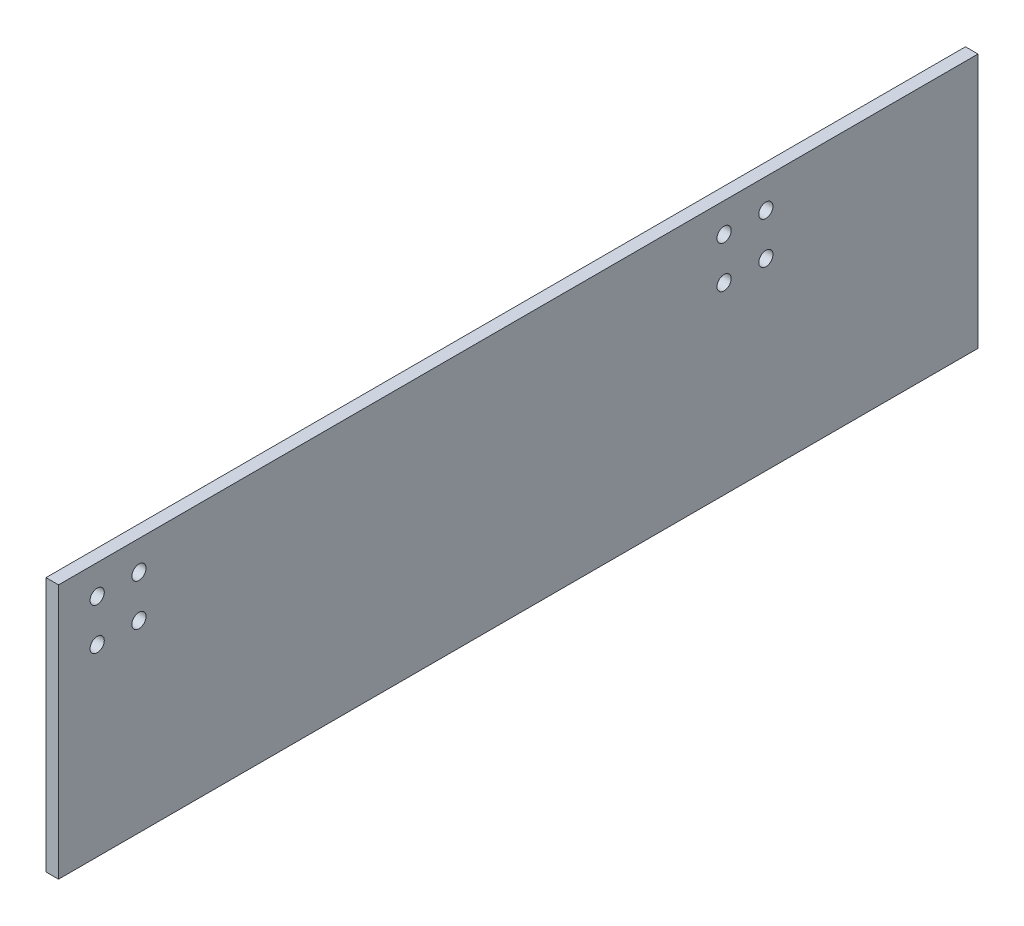
from build123d import *

# Parameters (mm, degrees)
SKETCH1_W                      = 3
SKETCH1_H                      = 76
BOSS_EXTRUDE1_DEPTH            = 220
M3_CLEARANCE_HOLE1_D           = 3.4
M3_CLEARANCE_HOLE1_CSINK_D     = 3.45
M3_CLEARANCE_HOLE1_CSINK_ANGLE = 90
SKETCH4_W                      = 220
SKETCH4_H                      = 15
CUT_EXTRUDE1_DEPTH             = 233.776717049


with BuildPart() as part:
    # Sketch1 → Boss-Extrude1 (new body)
    with BuildSketch(Plane.XY):
        with Locations((1.5, 38)):
            Rectangle(SKETCH1_W, SKETCH1_H)
    extrude(amount=BOSS_EXTRUDE1_DEPTH)

    # M3 Clearance Hole1 (through all)
    with Locations(Plane.ZY):
        with Locations((50.754682085, 59), (60.754682085, 59), (60.754682085, 69), (50.754682085, 69), (200.754682085, 59), (200.754682085, 69), (210.754682085, 59), (210.754682085, 69)):
            CounterSinkHole(M3_CLEARANCE_HOLE1_D / 2, M3_CLEARANCE_HOLE1_CSINK_D / 2, counter_sink_angle=M3_CLEARANCE_HOLE1_CSINK_ANGLE)

    # Sketch4 → Cut-Extrude1 (cut, through all)
    with BuildSketch(Plane.ZY):
        with Locations((110, 7.5)):
            Rectangle(SKETCH4_W, SKETCH4_H)
    extrude(amount=-CUT_EXTRUDE1_DEPTH, mode=Mode.SUBTRACT)


solid = part.part
